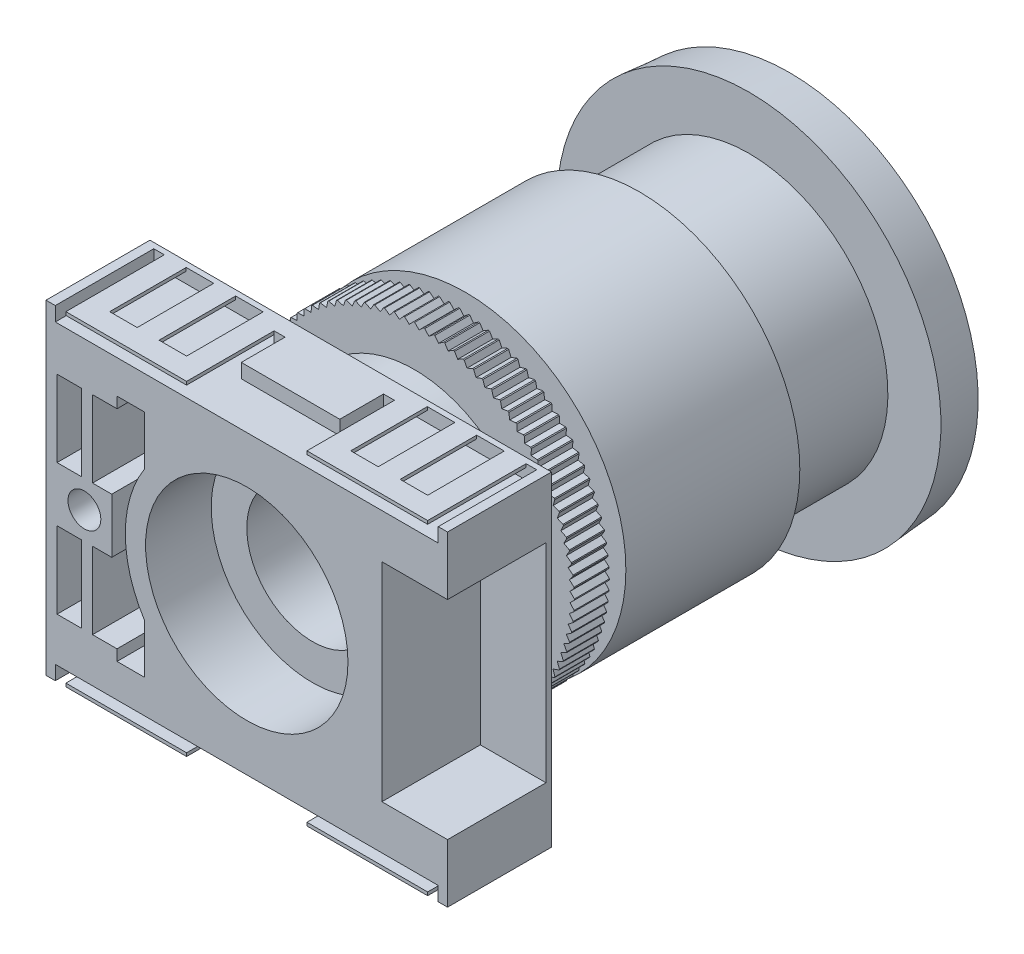
from build123d import *

# Parameters (mm, degrees)
SKETCH_3_R                 = 10.9
EXTRUDE_1_DEPTH            = 20
SKETCH_4_R                 = 6
CUT_EXTRUDE_1_DEPTH        = 49
SKETCH_5_R                 = 9.25
CUT_EXTRUDE_2_DEPTH        = 6
SKETCH_7_R                 = 14.7
SKETCH_7_R_2               = 10.9
EXTRUDE_2_DEPTH            = 3.2
CUT_EXTRUDE_START          = -3.2
CUT_EXTRUDE_3_DEPTH        = 3.2
PATTERN_CIRCULAR_1_COUNT   = 100
SKETCH_10_OUTSIDE_W        = 51.234
SKETCH_10_OUTSIDE_H        = 51.234
SKETCH_10_OUTSIDE_R        = 14.65
CUT_EXTRUDE_4_DEPTH        = 3.2
EXTRUDE_START              = -9.5
SKETCH_11_W                = 36.7
SKETCH_11_H                = 29.7
SKETCH_11_R                = 10.9
EXTRUDE_3_DEPTH            = 9.5
CUT_EXTRUDE_5_DEPTH        = 9
EXTRUDE_5_DEPTH            = 1.3
CUT_EXTRUDE_6_REACH        = 64.583
SKETCH_16_W                = 0.966876064
SKETCH_16_H                = 9
SKETCH_16_W_2              = 2.516561968
SKETCH_16_H_2              = 7
EXTRUDE_6_DEPTH            = 1.3
MIRROR_4_COPY_1_REACH      = 64.583
MIRROR_4_COPY_1_SKETCH_W   = 0.966876064
MIRROR_4_COPY_1_SKETCH_H   = 9
MIRROR_4_COPY_1_SKETCH_W_2 = 2.516561968
MIRROR_4_COPY_1_SKETCH_H_2 = 7
SKETCH_18_W                = 2.24
SKETCH_18_H                = 7
SKETCH_18_R                = 1.5
CUT_EXTRUDE_7_DEPTH        = 9
SKETCH_19_W                = 6
SKETCH_19_H                = 19
CUT_EXTRUDE_8_DEPTH        = 9


with BuildPart() as part:
    # ｽｹｯﾁ2 → 回転1 (revolve)
    with BuildSketch(Plane(origin=(0, 0, 0), x_dir=(0, 0, -1), z_dir=(1, 0, 0))):
        with BuildLine():
            Line((-30.3, 0), (-30.3, 14.65))
            Line((-30.3, 14.65), (-14.4, 14.65))
            Line((-14.4, 14.65), (-14.4, 12.8))
            Line((-14.4, 12.8), (-28.4, 12.8))
            Line((-28.4, 12.8), (-28.4, 12.7))
            Line((-28.4, 12.7), (-14.4, 12.7))
            Line((-14.4, 12.7), (-4.4, 12.7))
            Line((-4.4, 12.7), (-4.4, 17.55))
            Line((-4.4, 17.55), (-0.7, 17.25))
            Line((-0.7, 17.25), (-0.7, 15.9))
            Line((-0.7, 15.9), (-1.9, 15.9))
            ThreePointArc((-1.9, 15.9), (-2.9, 14.9), (-1.9, 13.9))
            Line((-1.9, 13.9), (-0.7, 13.9))
            ThreePointArc((-0.7, 13.9), (-0.175110814, 6.958807369), (0, 0))
            Line((0, 0), (-30.3, 0))
        make_face()
    revolve(axis=Axis((0, 0, 0), (0, 0, 1)))

    # ｽｹｯﾁ3 → ﾎﾞｽ - 押し出し1 (add)
    with BuildSketch(Plane.XY.offset(30.3)):
        Circle(SKETCH_3_R)
    extrude(amount=EXTRUDE_1_DEPTH)

    # ｽｹｯﾁ4 → ｶｯﾄ - 押し出し1 (cut)
    with BuildSketch(Plane.XY.offset(50.3)):
        Circle(SKETCH_4_R)
    extrude(amount=-CUT_EXTRUDE_1_DEPTH, mode=Mode.SUBTRACT)

    # ｽｹｯﾁ5 → ｶｯﾄ - 押し出し2 (cut)
    with BuildSketch(Plane.XY.offset(50.3)):
        Circle(SKETCH_5_R)
    extrude(amount=-CUT_EXTRUDE_2_DEPTH, mode=Mode.SUBTRACT)

    # ｽｹｯﾁ7 → ﾎﾞｽ - 押し出し2 (add)
    with BuildSketch(Plane.XY.offset(31.8)):
        Circle(SKETCH_7_R)
        Circle(SKETCH_7_R_2, mode=Mode.SUBTRACT)
    extrude(amount=EXTRUDE_2_DEPTH)

    # ｽｹｯﾁ9 → ｶｯﾄ - 押し出し3 (cut)
    with BuildSketch(Plane.XY.offset(35).offset(CUT_EXTRUDE_START)):
        with BuildLine():
            Line((0.447603317, 14.242968485), (0.461738158, 14.692746437))
            ThreePointArc((0.461738158, 14.692746437), (0.230897564, 14.698186497), (0, 14.7))
            Line((0, 14.7), (0.447603317, 14.242968485))
        make_face()
        with BuildLine():
            ThreePointArc((0.923020637, 14.670992908), (0.692464825, 14.683681162), (0.461738158, 14.692746437))
            Line((0.461738158, 14.692746437), (0.447603317, 14.242968485))
            Line((0.447603317, 14.242968485), (0.923020637, 14.670992908))
        make_face()
    cut_extrude_3 = extrude(amount=CUT_EXTRUDE_3_DEPTH, mode=Mode.SUBTRACT)

    # 円形ﾊﾟﾀｰﾝ1: ｶｯﾄ - 押し出し3 ×100 about axis
    pattern_circular_1_axis = Axis((0, 0, 0), (0, 0, 1))
    for i in range(1, PATTERN_CIRCULAR_1_COUNT):
        add(cut_extrude_3.rotate(pattern_circular_1_axis, i * 360 / PATTERN_CIRCULAR_1_COUNT), mode=Mode.SUBTRACT)

    # ｽｹｯﾁ10 outside → ｶｯﾄ - 押し出し4 (cut)
    with BuildSketch(Plane.XY.offset(35)):
        Rectangle(SKETCH_10_OUTSIDE_W, SKETCH_10_OUTSIDE_H)
        with Locations(Location((0, 0, 0), (0, 0, 90))):
            Circle(SKETCH_10_OUTSIDE_R, mode=Mode.SUBTRACT)
    extrude(amount=-CUT_EXTRUDE_4_DEPTH, mode=Mode.SUBTRACT)

    # ｽｹｯﾁ11 → ﾎﾞｽ - 押し出し3 (add)
    with BuildSketch(Plane.XY.offset(50.3).offset(EXTRUDE_START)):
        Rectangle(SKETCH_11_W, SKETCH_11_H)
        Circle(SKETCH_11_R, mode=Mode.SUBTRACT)
    extrude(amount=EXTRUDE_3_DEPTH)

    # ｽｹｯﾁ13 → ｶｯﾄ - 押し出し5 (cut)
    with BuildSketch(Plane.XY.offset(50.3)):
        Polygon((-17.5, 14.55), (-17.5, 13.55), (17.5, 13.55), (17.5, 14.55), (5.5, 14.55), (5.5, 16.15), (-5.5, 16.15), (-5.5, 14.55), align=None)
    cut_extrude_5 = extrude(amount=-CUT_EXTRUDE_5_DEPTH, mode=Mode.SUBTRACT)

    # ｽｹｯﾁ15 → ﾎﾞｽ - 押し出し5 (add)
    with BuildSketch(Plane(origin=(0, 13.55, 0), x_dir=(-1, 0, 0), z_dir=(0, 1, 0))):
        Polygon((-5.5, 41.3), (5.5, 41.3), (5.5, 42.3), (4.5, 42.3), (4.5, 46.3), (-4.5, 46.3), (-4.5, 42.3), (-5.5, 42.3), align=None)
    extrude(amount=EXTRUDE_5_DEPTH)

    # ｽｹｯﾁ16 → ｶｯﾄ - 押し出し6 (cut, up to next)
    with BuildSketch(Plane(origin=(0, 14.85, 0), x_dir=(1, 0, 0), z_dir=(0, 1, 0)), mode=Mode.PRIVATE) as cut_extrude_6_sk1:
        with Locations((-17.016561968, -45.8)):
            Rectangle(SKETCH_16_W, SKETCH_16_H)
    cut_extrude_6_tool1 = extrude(cut_extrude_6_sk1.sketch, amount=-CUT_EXTRUDE_6_REACH, mode=Mode.PRIVATE) & part.part
    # ｽｹｯﾁ16 → ｶｯﾄ - 押し出し6 (cut, up to next)
    with BuildSketch(Plane(origin=(0, 14.85, 0), x_dir=(1, 0, 0), z_dir=(0, 1, 0)), mode=Mode.PRIVATE) as cut_extrude_6_sk2:
        with Locations((-13.274842952, -44.8)):
            Rectangle(SKETCH_16_W_2, SKETCH_16_H_2)
    cut_extrude_6_tool2 = extrude(cut_extrude_6_sk2.sketch, amount=-CUT_EXTRUDE_6_REACH, mode=Mode.PRIVATE) & part.part
    # ｽｹｯﾁ16 → ｶｯﾄ - 押し出し6 (cut, up to next)
    with BuildSketch(Plane(origin=(0, 14.85, 0), x_dir=(1, 0, 0), z_dir=(0, 1, 0)), mode=Mode.PRIVATE) as cut_extrude_6_sk3:
        with Locations((-8.758280984, -44.8)):
            Rectangle(SKETCH_16_W_2, SKETCH_16_H_2)
    cut_extrude_6_tool3 = extrude(cut_extrude_6_sk3.sketch, amount=-CUT_EXTRUDE_6_REACH, mode=Mode.PRIVATE) & part.part
    cut_extrude_6_1 = cut_extrude_6_tool1.solids().sort_by_distance((-17.016562, 14.85, 45.8))[0]
    add(cut_extrude_6_1, mode=Mode.SUBTRACT)
    cut_extrude_6_2 = cut_extrude_6_tool2.solids().sort_by_distance((-13.274843, 14.85, 44.8))[0]
    add(cut_extrude_6_2, mode=Mode.SUBTRACT)
    cut_extrude_6_3 = cut_extrude_6_tool3.solids().sort_by_distance((-8.758281, 14.85, 44.8))[0]
    add(cut_extrude_6_3, mode=Mode.SUBTRACT)
    cut_extrude_6 = cut_extrude_6_1 + cut_extrude_6_2 + cut_extrude_6_3  # ｶｯﾄ - 押し出し6 as one shape, for the pattern or mirror that repeats it

    # ﾐﾗｰ1: ｶｯﾄ - 押し出し6 across plane
    add(cut_extrude_6.mirror(Plane(origin=(0, 0, 0), x_dir=(0, 0, 1), z_dir=(1, 0, 0))), mode=Mode.SUBTRACT)

    # ﾐﾗｰ2: ｶｯﾄ - 押し出し5 across plane
    add(cut_extrude_5.mirror(Plane.ZX), mode=Mode.SUBTRACT)

    # ｽｹｯﾁ17 → ﾎﾞｽ - 押し出し6 (add)
    with BuildSketch(Plane.XZ.offset(13.55)):
        Polygon((-5.5, 41.3), (5.5, 41.3), (5.5, 42.3), (4.5, 42.3), (4.5, 47.3), (-4.5, 47.3), (-4.5, 42.3), (-5.5, 42.3), align=None)
    extrude(amount=EXTRUDE_6_DEPTH)

    # ﾐﾗｰ4: ｶｯﾄ - 押し出し6 across plane
    add(cut_extrude_6.mirror(Plane.ZX), mode=Mode.SUBTRACT)

    # ﾐﾗｰ4 copy 1 sketch → ﾐﾗｰ4 copy 1 (cut, up to next)
    with BuildSketch(Plane(origin=(0, -14.85, 0), x_dir=(-1, 0, 0), z_dir=(0, -1, 0)), mode=Mode.PRIVATE) as mirror_4_copy_1_sk1:
        with Locations((-17.016561968, -45.8)):
            Rectangle(MIRROR_4_COPY_1_SKETCH_W, MIRROR_4_COPY_1_SKETCH_H)
    mirror_4_copy_1_tool1 = extrude(mirror_4_copy_1_sk1.sketch, amount=-MIRROR_4_COPY_1_REACH, mode=Mode.PRIVATE) & part.part
    # ﾐﾗｰ4 copy 1 sketch → ﾐﾗｰ4 copy 1 (cut, up to next)
    with BuildSketch(Plane(origin=(0, -14.85, 0), x_dir=(-1, 0, 0), z_dir=(0, -1, 0)), mode=Mode.PRIVATE) as mirror_4_copy_1_sk2:
        with Locations((-13.274842952, -44.8)):
            Rectangle(MIRROR_4_COPY_1_SKETCH_W_2, MIRROR_4_COPY_1_SKETCH_H_2)
    mirror_4_copy_1_tool2 = extrude(mirror_4_copy_1_sk2.sketch, amount=-MIRROR_4_COPY_1_REACH, mode=Mode.PRIVATE) & part.part
    # ﾐﾗｰ4 copy 1 sketch → ﾐﾗｰ4 copy 1 (cut, up to next)
    with BuildSketch(Plane(origin=(0, -14.85, 0), x_dir=(-1, 0, 0), z_dir=(0, -1, 0)), mode=Mode.PRIVATE) as mirror_4_copy_1_sk3:
        with Locations((-8.758280984, -44.8)):
            Rectangle(MIRROR_4_COPY_1_SKETCH_W_2, MIRROR_4_COPY_1_SKETCH_H_2)
    mirror_4_copy_1_tool3 = extrude(mirror_4_copy_1_sk3.sketch, amount=-MIRROR_4_COPY_1_REACH, mode=Mode.PRIVATE) & part.part
    add(mirror_4_copy_1_tool1.solids().sort_by_distance((17.016562, -14.85, 45.8))[0], mode=Mode.SUBTRACT)
    add(mirror_4_copy_1_tool2.solids().sort_by_distance((13.274843, -14.85, 44.8))[0], mode=Mode.SUBTRACT)
    add(mirror_4_copy_1_tool3.solids().sort_by_distance((8.758281, -14.85, 44.8))[0], mode=Mode.SUBTRACT)

    # ｽｹｯﾁ18 → ｶｯﾄ - 押し出し7 (cut)
    with BuildSketch(Plane.XY.offset(50.3)):
        with Locations((-16.219737338, 6)):
            Rectangle(SKETCH_18_W, SKETCH_18_H)
        with BuildLine():
            Line((-11.859737338, -9.5), (-11.859737338, -10.5))
            Line((-11.859737338, -10.5), (-9.339737338, -10.5))
            Line((-9.339737338, -10.5), (-9.339737338, -6))
            ThreePointArc((-9.339737338, -6), (-11.100932103, 0), (-9.339737338, 6))
            Line((-9.339737338, 6), (-9.339737338, 10.5))
            Line((-9.339737338, 10.5), (-11.859737338, 10.5))
            Line((-11.859737338, 10.5), (-11.859737338, 9.5))
            Line((-11.859737338, 9.5), (-14.099737338, 9.5))
            Line((-14.099737338, 9.5), (-14.099737338, 2.5))
            Line((-14.099737338, 2.5), (-12.339737338, 2.5))
            Line((-12.339737338, 2.5), (-12.339737338, -2.5))
            Line((-12.339737338, -2.5), (-14.099737338, -2.5))
            Line((-14.099737338, -2.5), (-14.099737338, -9.5))
            Line((-14.099737338, -9.5), (-11.859737338, -9.5))
        make_face()
        with Locations((-16.219737338, -6)):
            Rectangle(SKETCH_18_W, SKETCH_18_H)
        with Locations((-14.839737338, 0)):
            Circle(SKETCH_18_R)
    extrude(amount=-CUT_EXTRUDE_7_DEPTH, mode=Mode.SUBTRACT)

    # ｽｹｯﾁ19 → ｶｯﾄ - 押し出し8 (cut)
    with BuildSketch(Plane.XY.offset(50.3)):
        with Locations((15.35, 0)):
            Rectangle(SKETCH_19_W, SKETCH_19_H)
    extrude(amount=-CUT_EXTRUDE_8_DEPTH, mode=Mode.SUBTRACT)


solid = part.part
